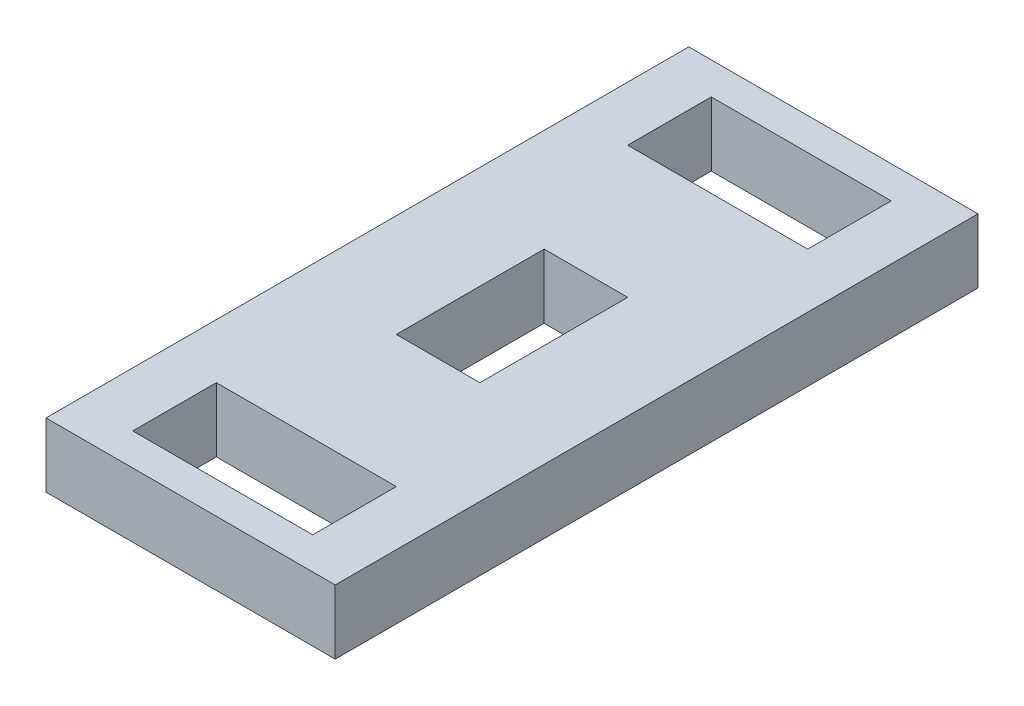
from build123d import *

# Parameters (mm, degrees)
ESQUISSE1_W                  = 9
ESQUISSE1_H                  = 20
ESQUISSE1_W_2                = 5.6
ESQUISSE1_H_2                = 2.6
BOSS_EXTRU_1_DEPTH           = 2
ENL_V_MAT_EXTRU_1_DEPTH      = 20.874043493
ENL_V_MAT_EXTRU_1_DEPTH_BACK = 20.874043493
ESQUISSE2_W                  = 2.6
ESQUISSE2_H                  = 4.6


with BuildPart() as part:
    # Esquisse1 → Boss.-Extru.1 (new body)
    with BuildSketch(Plane(origin=(0, 0, 0), x_dir=(1, 0, 0), z_dir=(0, 1, 0))):
        with Locations((3.408982136, 8.122516556)):
            Rectangle(ESQUISSE1_W, ESQUISSE1_H)
        with Locations((3.408982136, 0.422516556)):
            Rectangle(ESQUISSE1_W_2, ESQUISSE1_H_2, mode=Mode.SUBTRACT)
        with Locations((3.408982136, 15.822516556)):
            Rectangle(ESQUISSE1_W_2, ESQUISSE1_H_2, mode=Mode.SUBTRACT)
    extrude(amount=BOSS_EXTRU_1_DEPTH)

    # Esquisse2 → Enlèv. mat.-Extru.1 (cut, two sides: drawn at the far end of the back side and taken through both)
    with BuildSketch(Plane.XZ.offset(-ENL_V_MAT_EXTRU_1_DEPTH_BACK)):
        with Locations((3.408982136, -8.122516556)):
            Rectangle(ESQUISSE2_W, ESQUISSE2_H)
    extrude(amount=ENL_V_MAT_EXTRU_1_DEPTH + ENL_V_MAT_EXTRU_1_DEPTH_BACK, mode=Mode.SUBTRACT)


solid = part.part
